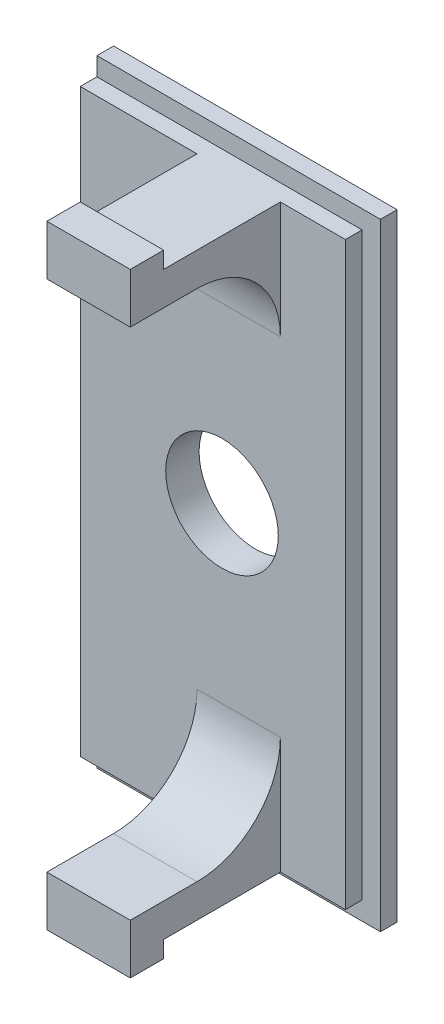
from build123d import *

# Parameters (mm, degrees)
ESQUISSE1_W        = 34
ESQUISSE1_H        = 74
BOSS_EXTRU_1_DEPTH = 2
ESQUISSE2_W        = 31.8
ESQUISSE2_H        = 69.6
BOSS_EXTRU_2_DEPTH = 2
ESQUISSE7_W        = 10
ESQUISSE7_H        = 4
BOSS_EXTRU_5_DEPTH = 18
ESQUISSE8_W        = 10
ESQUISSE8_H        = 2
BOSS_EXTRU_6_DEPTH = 4
CONG_2_R           = 10
SKETCH1_R          = 6.75
CUT_EXTRUDE1_DEPTH = 47.281745862


with BuildPart() as part:
    # Esquisse1 → Boss.-Extru.1 (new body)
    with BuildSketch(Plane.XY):
        Rectangle(ESQUISSE1_W, ESQUISSE1_H)
    extrude(amount=BOSS_EXTRU_1_DEPTH)

    # Esquisse2 → Boss.-Extru.2 (add)
    with BuildSketch(Plane.XY.offset(2)):
        with Locations((-1.1, 0)):
            Rectangle(ESQUISSE2_W, ESQUISSE2_H)
    extrude(amount=BOSS_EXTRU_2_DEPTH)

    # Esquisse7 → Boss.-Extru.5 (add)
    with BuildSketch(Plane.XY.offset(4)):
        with Locations((2, 32.8)):
            Rectangle(ESQUISSE7_W, ESQUISSE7_H)
        with Locations((2, -32.8)):
            Rectangle(ESQUISSE7_W, ESQUISSE7_H)
    extrude(amount=BOSS_EXTRU_5_DEPTH)

    # Esquisse8 → Boss.-Extru.6 (add)
    with BuildSketch(Plane.XY.offset(22)):
        with Locations((2, 35.8)):
            Rectangle(ESQUISSE8_W, ESQUISSE8_H)
        with Locations((2, -35.8)):
            Rectangle(ESQUISSE8_W, ESQUISSE8_H)
    extrude(amount=-BOSS_EXTRU_6_DEPTH)

    # Congé2
    cong_2_edges = [part.edges().sort_by_distance(p)[0] for p in [
        (2, 30.8, 4),
        (2, -30.8, 4),
    ]]
    fillet(cong_2_edges, radius=CONG_2_R)

    # Sketch1 → Cut-Extrude1 (cut, through all)
    with BuildSketch(Plane(origin=(0, 0, 0), x_dir=(-1, 0, 0), z_dir=(0, 0, -1))):
        Circle(SKETCH1_R)
    extrude(amount=-CUT_EXTRUDE1_DEPTH, mode=Mode.SUBTRACT)


solid = part.part
